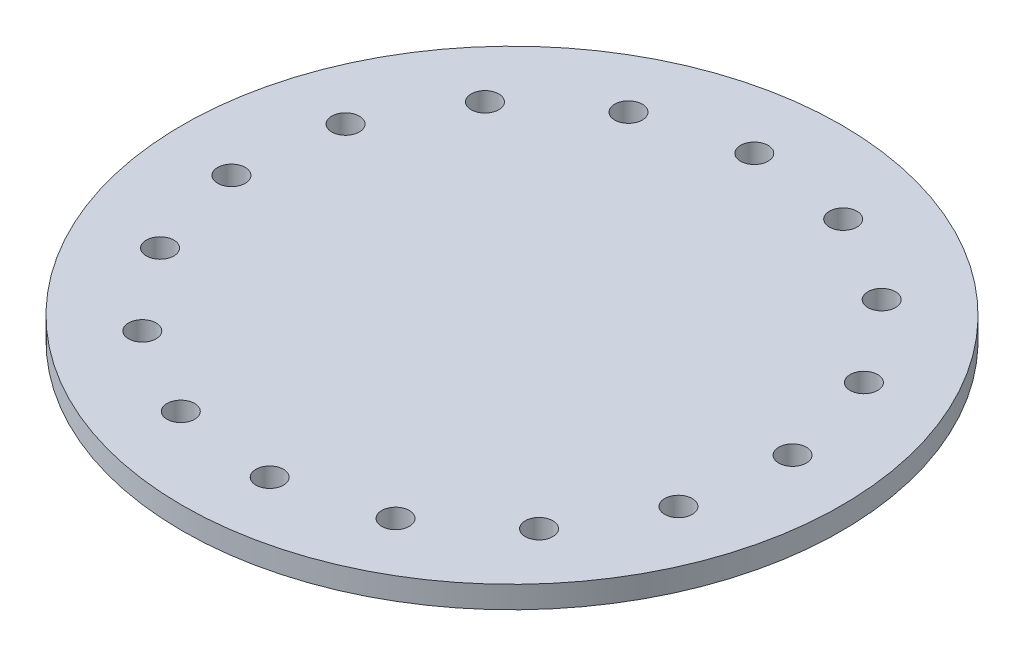
from build123d import *

# Parameters (mm, degrees)
SKETCH1_R               = 29.86111111
BOSS_EXTRUDE1_DEPTH     = 1
CUT_EXTRUDE1_DEPTH      = 43.277321503
CUT_EXTRUDE1_DEPTH_BACK = 43.277321503
SKETCH2_R               = 1.25


with BuildPart() as part:
    # Sketch1 → Boss-Extrude1 (new, symmetric)
    with BuildSketch(Plane(origin=(0, 0, 0), x_dir=(1, 0, 0), z_dir=(0, 1, 0))):
        Circle(SKETCH1_R)
    extrude(amount=BOSS_EXTRUDE1_DEPTH, both=True)

    # Sketch2 → Cut-Extrude1 (cut, two sides: drawn at the far end of the back side and taken through both)
    with BuildSketch(Plane(origin=(0, 1, 0), x_dir=(1, 0, 0), z_dir=(0, 1, 0)).offset(-CUT_EXTRUDE1_DEPTH_BACK)):
        with Locations((1.733610724, -23.686643786)):
            Circle(SKETCH2_R)
        with Locations((-7.46283868, -22.54702949)):
            Circle(SKETCH2_R)
        with Locations((-15.523138546, -17.974834344)):
            Circle(SKETCH2_R)
        with Locations((-21.220181286, -10.66613361)):
            Circle(SKETCH2_R)
        with Locations((-23.686643786, -1.733610724)):
            Circle(SKETCH2_R)
        with Locations((-22.54702949, 7.46283868)):
            Circle(SKETCH2_R)
        with Locations((-17.974834344, 15.523138546)):
            Circle(SKETCH2_R)
        with Locations((-10.66613361, 21.220181286)):
            Circle(SKETCH2_R)
        with Locations((-1.733610724, 23.686643786)):
            Circle(SKETCH2_R)
        with Locations((10.66613361, -21.220181286)):
            Circle(SKETCH2_R)
        with Locations((17.974834344, -15.523138546)):
            Circle(SKETCH2_R)
        with Locations((22.54702949, -7.46283868)):
            Circle(SKETCH2_R)
        with Locations((23.686643786, 1.733610724)):
            Circle(SKETCH2_R)
        with Locations((21.220181286, 10.66613361)):
            Circle(SKETCH2_R)
        with Locations((15.523138546, 17.974834344)):
            Circle(SKETCH2_R)
        with Locations((7.46283868, 22.54702949)):
            Circle(SKETCH2_R)
    extrude(amount=CUT_EXTRUDE1_DEPTH + CUT_EXTRUDE1_DEPTH_BACK, mode=Mode.SUBTRACT)


solid = part.part
